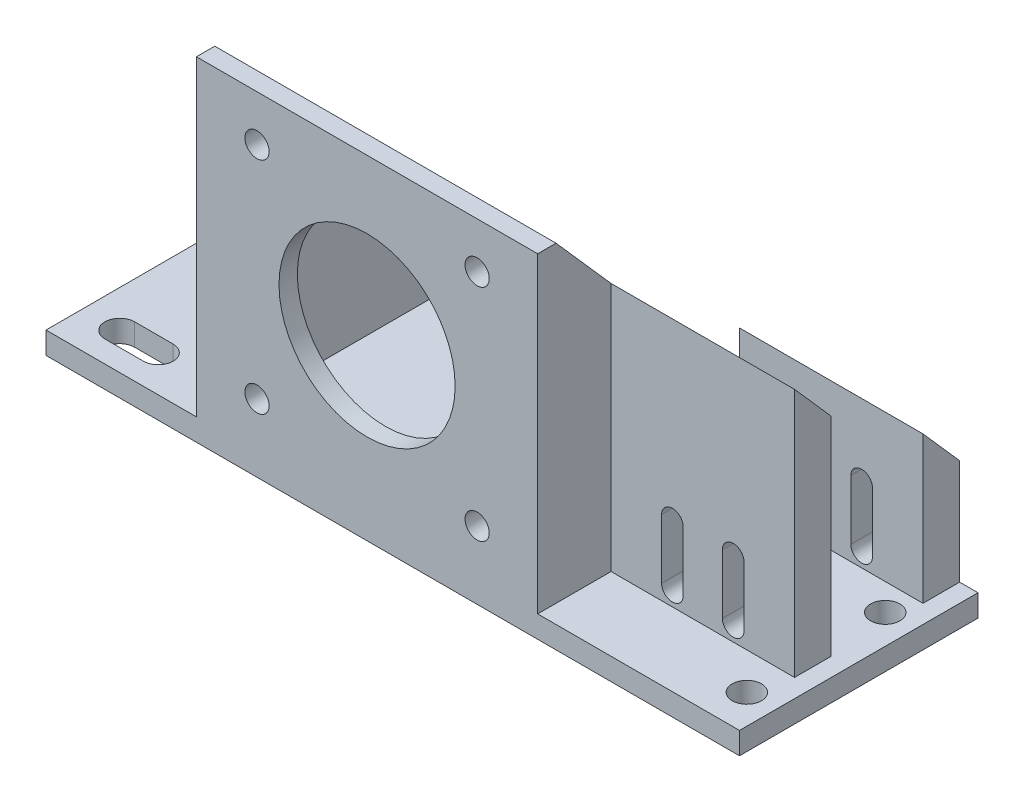
from build123d import *

# Parameters (mm, degrees)
SKETCH1_W               = 94.5
SKETCH1_H               = 40
SKETCH1_R               = 2
BOSS_EXTRUDE1_DEPTH     = 3
BOSS_EXTRUDE2_DEPTH     = 42.5
CUT_EXTRUDE1_DEPTH      = 88.459990853
SKETCH4_R               = 12
SKETCH4_R_2             = 1.65
CUT_EXTRUDE2_DEPTH      = 102.95219468
SKETCH7_W               = 25
SKETCH7_H               = 5
BOSS_EXTRUDE3_DEPTH     = 20
BOSS_EXTRUDE4_REACH     = 102.649
SKETCH7_3_W             = 25
SKETCH7_3_H             = 5
CUT_EXTRUDE3_DEPTH      = 99.459382488
CUT_EXTRUDE4_DEPTH      = 91.32856691
CUT_EXTRUDE5_DEPTH      = 101.649143066
CUT_EXTRUDE5_DEPTH_BACK = 101.649143066
SKETCH13_W              = 94.5
SKETCH13_H              = 7.5


with BuildPart() as part:
    # Sketch1 → Boss-Extrude1 (new body)
    with BuildSketch(Plane(origin=(0, 0, 0), x_dir=(1, 0, 0), z_dir=(0, 1, 0))):
        with Locations((34.75, 20)):
            Rectangle(SKETCH1_W, SKETCH1_H)
        with Locations((78, 5)):
            Circle(SKETCH1_R, mode=Mode.SUBTRACT)
        with Locations((78, 23.86)):
            Circle(SKETCH1_R, mode=Mode.SUBTRACT)
        with BuildLine():
            Line((-7.5, 25.885), (-2.25, 25.885))
            ThreePointArc((-2.25, 25.885), (-0.225, 23.86), (-2.25, 21.835))
            Line((-2.25, 21.835), (-7.5, 21.835))
            ThreePointArc((-7.5, 21.835), (-9.525, 23.86), (-7.5, 25.885))
        make_face(mode=Mode.SUBTRACT)
        with BuildLine():
            ThreePointArc((-7.432927118, 2.96), (-9.457927118, 4.985), (-7.432927118, 7.01))
            Line((-7.432927118, 7.01), (-2.182927118, 7.01))
            ThreePointArc((-2.182927118, 7.01), (-0.157927118, 4.985), (-2.182927118, 2.96))
            Line((-2.182927118, 2.96), (-7.432927118, 2.96))
        make_face(mode=Mode.SUBTRACT)
    extrude(amount=BOSS_EXTRUDE1_DEPTH)

    # Sketch2 → Boss-Extrude2 (add)
    with BuildSketch(Plane(origin=(0, 3, 0), x_dir=(1, 0, 0), z_dir=(0, 1, 0))):
        Polygon((10, 2.5), (10, 40), (8, 40), (8, 0), (54.5, 0), (54.5, 40), (52.5, 40), (52.5, 2.5), align=None)
    extrude(amount=BOSS_EXTRUDE2_DEPTH)

    # Sketch3 → Cut-Extrude1 (cut, through all)
    with BuildSketch(Plane(origin=(54.5, 6, 0), x_dir=(0, 0, -1), z_dir=(-1, 0, 0))):
        Polygon((2.5, -39.5), (40, -39.5), (40, 3), align=None)
    extrude(amount=CUT_EXTRUDE1_DEPTH, mode=Mode.SUBTRACT)

    # Sketch4 → Cut-Extrude2 (cut, through all)
    with BuildSketch(Plane.XY):
        with Locations((31.25, 24.25)):
            Circle(SKETCH4_R)
        with Locations((16.25, 39.25)):
            Circle(SKETCH4_R_2)
        with Locations((16.25, 9.25)):
            Circle(SKETCH4_R_2)
        with Locations((46.25, 9.25)):
            Circle(SKETCH4_R_2)
        with Locations((46.25, 39.25)):
            Circle(SKETCH4_R_2)
    extrude(amount=-CUT_EXTRUDE2_DEPTH, mode=Mode.SUBTRACT)

    # Sketch7 → Boss-Extrude3 (add)
    with BuildSketch(Plane(origin=(0, 3, 0), x_dir=(1, 0, 0), z_dir=(0, 1, 0))):
        with Locations((67, 30)):
            Rectangle(SKETCH7_W, SKETCH7_H)
    extrude(amount=BOSS_EXTRUDE3_DEPTH)

    # Boss-Extrude4: up to this plane
    boss_extrude4_end = Plane(origin=(-12.5, 21.157587549, -23.978599222), z_dir=(0, -0.6616216370868465, 0.7498378553650924))
    # Sketch7<3> → Boss-Extrude4 (add, up to the surface)
    with BuildSketch(Plane(origin=(0, 3, 0), x_dir=(1, 0, 0), z_dir=(0, 1, 0)), mode=Mode.PRIVATE) as boss_extrude4_sk1:
        with Locations((67, 12.5)):
            Rectangle(SKETCH7_3_W, SKETCH7_3_H)
    boss_extrude4_tool1 = split(extrude(boss_extrude4_sk1.sketch, amount=BOSS_EXTRUDE4_REACH, mode=Mode.PRIVATE), bisect_by=boss_extrude4_end, keep=Keep.BOTH, mode=Mode.PRIVATE)
    add(boss_extrude4_tool1.solids().sort_by_distance((67, 3, -12.5))[0])

    # Sketch9 → Cut-Extrude3 (cut, through all)
    with BuildSketch(Plane.XY.offset(-10)):
        with BuildLine():
            Line((64.330095427, 5.052055091), (64.330095427, 13.170078856))
            ThreePointArc((64.330095427, 13.170078856), (62.856131757, 14.644042526), (61.382168087, 13.170078856))
            Line((61.382168087, 13.170078856), (61.382168087, 5.052055091))
            ThreePointArc((61.382168087, 5.052055091), (62.856131757, 3.578091421), (64.330095427, 5.052055091))
        make_face()
        with BuildLine():
            ThreePointArc((72.617831913, 13.170078856), (71.143868243, 14.644042526), (69.669904573, 13.170078856))
            Line((69.669904573, 13.170078856), (69.669904573, 5.052055091))
            ThreePointArc((69.669904573, 5.052055091), (71.143868243, 3.578091421), (72.617831913, 5.052055091))
            Line((72.617831913, 5.052055091), (72.617831913, 13.170078856))
        make_face()
    extrude(amount=-CUT_EXTRUDE3_DEPTH, mode=Mode.SUBTRACT)

    # Sketch11 → Cut-Extrude4 (cut, through all)
    with BuildSketch(Plane.ZY.offset(-54.5)):
        Polygon((-32.5, 17.332602518), (-27.5, 23), (-32.5, 23), align=None)
    extrude(amount=-CUT_EXTRUDE4_DEPTH, mode=Mode.SUBTRACT)

    # Sketch13 → Cut-Extrude5 (cut, two sides: drawn at the far end of the back side and taken through both)
    with BuildSketch(Plane(origin=(0, 3, 0), x_dir=(1, 0, 0), z_dir=(0, 1, 0)).offset(-CUT_EXTRUDE5_DEPTH_BACK)):
        with Locations((34.75, 36.25)):
            Rectangle(SKETCH13_W, SKETCH13_H)
    extrude(amount=CUT_EXTRUDE5_DEPTH + CUT_EXTRUDE5_DEPTH_BACK, mode=Mode.SUBTRACT)


solid = part.part
